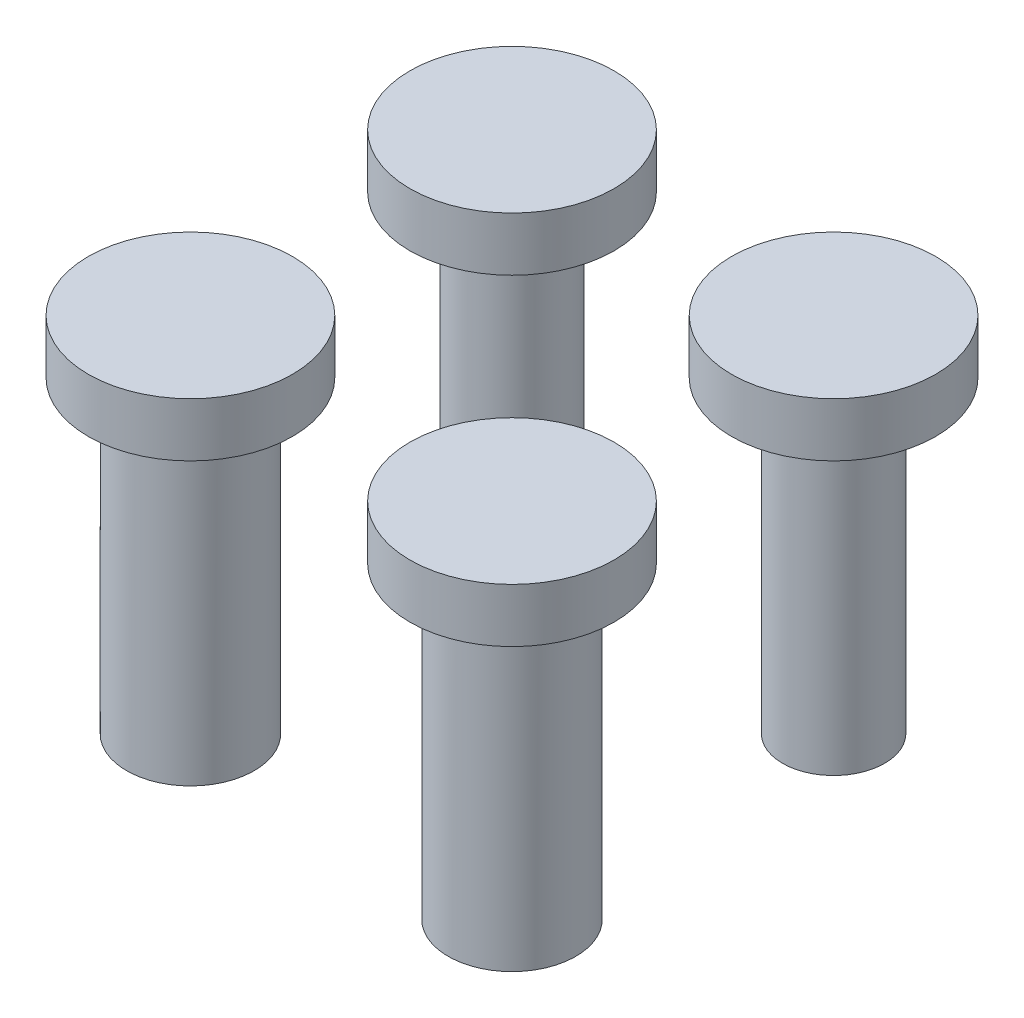
from build123d import *

# Parameters (mm, degrees)
SKETCH1_R                     = 3.175
BOSS_EXTRUDE1_DEPTH           = 20
SKETCH2_R                     = 1.675
CUT_EXTRUDE1_DEPTH            = 12
SKETCH4_R                     = 6.35
BOSS_EXTRUDE2_DEPTH           = 2.54
BOSS_EXTRUDE3_START           = -3.35
SKETCH6_R                     = 6.35
BOSS_EXTRUDE3_DEPTH           = 3.35
BODY_MOVE_COPY2_OUTLINE_R     = 3.175
BODY_MOVE_COPY2_OUTLINE_R_2   = 1.675
BODY_MOVE_COPY2_DEPTH         = 22.54
BODY_MOVE_COPY2_START         = 19.19
BODY_MOVE_COPY2_2_OUTLINE_R   = 6.35
BODY_MOVE_COPY2_2_OUTLINE_R_2 = 3.175
BODY_MOVE_COPY2_2_OUTLINE_R_3 = 1.675
BODY_MOVE_COPY2_2_DEPTH       = 3.35
BODY_MOVE_COPY2_START_2       = 12
BODY_MOVE_COPY2_3_OUTLINE_R   = 1.675
BODY_MOVE_COPY2_3_DEPTH       = 7.19
BOSS_EXTRUDE4_REACH           = 45.551
SKETCH8_R                     = 3.96875
SKETCH8_R_2                   = 1.675


# Read off the part's stored shape, not the designer's step: Body-Move/Copy2
with BuildPart() as part:
    # Sketch1 → Boss-Extrude1 (new body)
    with BuildSketch(Plane(origin=(0, 0, 0), x_dir=(1, 0, 0), z_dir=(0, 1, 0))):
        with Locations(Location((0, 0, 0), (0, 0, 270))):
            Circle(SKETCH1_R)
    extrude(amount=BOSS_EXTRUDE1_DEPTH)

    # Sketch2 → Cut-Extrude1 (cut)
    with BuildSketch(Plane.XZ):
        with Locations(Location((0, 0, 0), (0, 0, 270))):
            Circle(SKETCH2_R)
    extrude(amount=-CUT_EXTRUDE1_DEPTH, mode=Mode.SUBTRACT)

    # Sketch4 → Boss-Extrude2 (add)
    with BuildSketch(Plane(origin=(0, 20, 0), x_dir=(1, 0, 0), z_dir=(0, 1, 0))):
        with Locations(Location((0, 0, 0), (0, 0, 270))):
            Circle(SKETCH4_R)
    extrude(amount=BOSS_EXTRUDE2_DEPTH)

    # Sketch6 → Boss-Extrude3 (add)
    with BuildSketch(Plane(origin=(0, 22.54, 0), x_dir=(1, 0, 0), z_dir=(0, 1, 0)).offset(BOSS_EXTRUDE3_START)):
        with Locations(Location((0, 0, 0), (0, 0, 270))):
            Circle(SKETCH6_R)
    extrude(amount=BOSS_EXTRUDE3_DEPTH)


with BuildPart() as body_2:
    # Body-Move/Copy1: copy of part
    add(part.part.moved(Location((20, 0, 0))))


with BuildPart() as body_3:
    # Body-Move/Copy2 outline → Body-Move/Copy2 (new body)
    # profile 1 of 2: a face of its own
    with BuildSketch(Plane(origin=(0, 0, 0), x_dir=(1, 0, 0), z_dir=(0, 1, 0))):
        with Locations((20, -20)):
            Circle(BODY_MOVE_COPY2_OUTLINE_R)
        with Locations((20, -20)):
            Circle(BODY_MOVE_COPY2_OUTLINE_R_2, mode=Mode.SUBTRACT)
    # profile 2 of 2: a face of its own
    with BuildSketch(Plane(origin=(0, 0, 0), x_dir=(1, 0, 0), z_dir=(0, 1, 0))):
        with Locations((0, -20)):
            Circle(BODY_MOVE_COPY2_OUTLINE_R)
        with Locations((0, -20)):
            Circle(BODY_MOVE_COPY2_OUTLINE_R_2, mode=Mode.SUBTRACT)
    extrude(amount=BODY_MOVE_COPY2_DEPTH)



with BuildPart() as body_4:
    # Body-Move_Copy2 2 outline → Body-Move_Copy2 2 (new body)
    # profile 1 of 4: a face of its own
    with BuildSketch(Plane(origin=(0, 0, 0), x_dir=(1, 0, 0), z_dir=(0, 1, 0)).offset(BODY_MOVE_COPY2_START)):
        with Locations((20, -20)):
            Circle(BODY_MOVE_COPY2_2_OUTLINE_R)
        with Locations((20, -20)):
            Circle(BODY_MOVE_COPY2_2_OUTLINE_R_2, mode=Mode.SUBTRACT)
    # profile 2 of 4: a face of its own
    with BuildSketch(Plane(origin=(0, 0, 0), x_dir=(1, 0, 0), z_dir=(0, 1, 0)).offset(BODY_MOVE_COPY2_START)):
        with Locations((20, -20)):
            Circle(BODY_MOVE_COPY2_2_OUTLINE_R_3)
    # profile 3 of 4: a face of its own
    with BuildSketch(Plane(origin=(0, 0, 0), x_dir=(1, 0, 0), z_dir=(0, 1, 0)).offset(BODY_MOVE_COPY2_START)):
        with Locations((0, -20)):
            Circle(BODY_MOVE_COPY2_2_OUTLINE_R)
        with Locations((0, -20)):
            Circle(BODY_MOVE_COPY2_2_OUTLINE_R_2, mode=Mode.SUBTRACT)
    # profile 4 of 4: a face of its own
    with BuildSketch(Plane(origin=(0, 0, 0), x_dir=(1, 0, 0), z_dir=(0, 1, 0)).offset(BODY_MOVE_COPY2_START)):
        with Locations((0, -20)):
            Circle(BODY_MOVE_COPY2_2_OUTLINE_R_3)
    extrude(amount=BODY_MOVE_COPY2_2_DEPTH)


with BuildPart() as body_3_1:
    add(body_3.part)

    add(body_4.part)  # Body-Move_Copy2 3 merges body 4
    # Body-Move_Copy2 3 outline → Body-Move_Copy2 3 (add)
    with BuildSketch(Plane(origin=(0, 0, 0), x_dir=(1, 0, 0), z_dir=(0, 1, 0)).offset(BODY_MOVE_COPY2_START_2)):
        with Locations((20, -20)):
            Circle(BODY_MOVE_COPY2_3_OUTLINE_R)
        with Locations((0, -20)):
            Circle(BODY_MOVE_COPY2_3_OUTLINE_R)
    extrude(amount=BODY_MOVE_COPY2_3_DEPTH)

    # Sketch8 → Boss-Extrude4 (add, up to next)
    with BuildSketch(Plane.XZ, mode=Mode.PRIVATE) as boss_extrude4_sk1:
        with Locations(Location((0, 20, 0), (0, 0, 270))):
            Circle(SKETCH8_R)
        with Locations(Location((0, 20, 0), (0, 0, 270))):
            Circle(SKETCH8_R_2, mode=Mode.SUBTRACT)
    boss_extrude4_tool1 = extrude(boss_extrude4_sk1.sketch, amount=-BOSS_EXTRUDE4_REACH, mode=Mode.PRIVATE) - body_3_1.part
    # Sketch8 → Boss-Extrude4 (add, up to next)
    with BuildSketch(Plane.XZ, mode=Mode.PRIVATE) as boss_extrude4_sk2:
        with Locations(Location((20, 20, 0), (0, 0, 270))):
            Circle(SKETCH8_R)
        with Locations(Location((20, 20, 0), (0, 0, 270))):
            Circle(SKETCH8_R_2, mode=Mode.SUBTRACT)
    boss_extrude4_tool2 = extrude(boss_extrude4_sk2.sketch, amount=-BOSS_EXTRUDE4_REACH, mode=Mode.PRIVATE) - body_3_1.part
    add(boss_extrude4_tool1.solids().sort_by_distance((0, 0, 23.856497))[0])
    add(boss_extrude4_tool2.solids().sort_by_distance((20, 0, 23.856497))[0])


solid = Compound([part.part, body_2.part, body_3_1.part])
